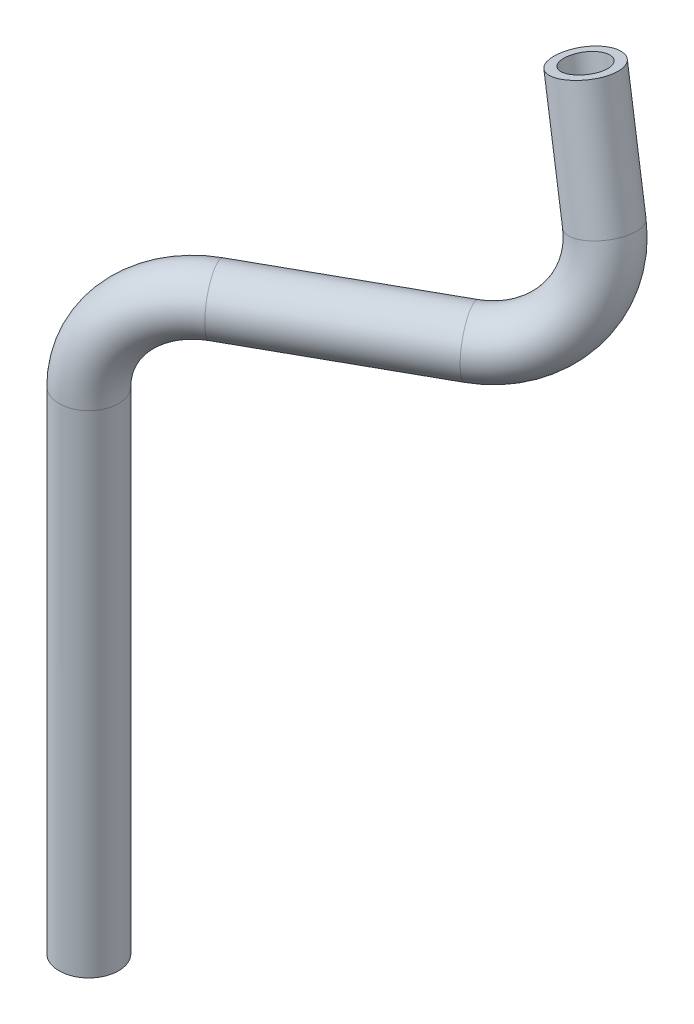
from build123d import *

# Parameters (mm, degrees)
SWEEP_THIN1_PROFILE_R     = 3.175
SWEEP_THIN1_PROFILE_R_2   = 2.175
BOSS_EXTRUDE1_OUTLINE_R   = 3.175
BOSS_EXTRUDE1_OUTLINE_R_2 = 2.175
BOSS_EXTRUDE1_DEPTH       = 5.033072262
BOSS_EXTRUDE1_START       = 3
BOSS_EXTRUDE1_2_DEPTH     = 8


with BuildPart() as part:
    # Sweep-Thin1: sweep along a curve in space
    with BuildLine() as sweep_thin1_path:
        Line((0, 0, 0), (0, 41.3, 0))
        Line((0, 41.3, 0), (0, 52.485381189, 0))
        ThreePointArc((8.731710823, 62.485381189, -4.874138499), (2.557458889, 59.556449001, -1.427602114), (0, 52.485381189, 0))
        Line((8.731710823, 62.485381189, -4.874138499), (26.239628077, 62.485381189, -14.647253442))
        ThreePointArc((26.239628077, 62.485381189, -14.647253442), (32.596698174, 65.949204532, -18.875029244), (33.90761411, 73.906143624, -21.166997899))
        Line((32.091284349, 81.948727145, -21.730096286), (33.90761411, 73.906143624, -21.166997899))
    # Sweep-Thin1 profile (on start of the path) → Sweep-Thin1 (sweep)
    with BuildSketch(Plane.ZX):
        Circle(SWEEP_THIN1_PROFILE_R)
        Circle(SWEEP_THIN1_PROFILE_R_2, mode=Mode.SUBTRACT)
    sweep(path=sweep_thin1_path.line)

    # Boss-Extrude1: read off the stored shape, not the designer's step
    # Boss-Extrude1 outline → Boss-Extrude1 (add)
    with BuildSketch(Plane(origin=(-16.302656388, 72.187043596, -5.054148045), x_dir=(0.9755496373305654, 0.2192425074835292, -0.015350179690706331), z_dir=(-0.21977921899989167, 0.973167297783081, -0.06813593340796047))):
        with Locations((49.606846115, 15.953433297)):
            Circle(BOSS_EXTRUDE1_OUTLINE_R)
        with Locations((49.606846115, 15.953433297)):
            Circle(BOSS_EXTRUDE1_OUTLINE_R_2, mode=Mode.SUBTRACT)
    extrude(amount=BOSS_EXTRUDE1_DEPTH)

    # Boss-Extrude1 2 outline → Boss-Extrude1 2 (cut)
    with BuildSketch(Plane(origin=(0, 0, 0), x_dir=(0.9092183851510403, -0.07176325268657005, -0.4100877511791569), z_dir=(0.41631950242972593, 0.156726908876634, 0.8956085908088649)).offset(BOSS_EXTRUDE1_START)):
        with BuildLine():
            ThreePointArc((30.991714154, 89.351616158), (32.537128586, 89.718539367), (34.090261078, 90.051282317))
            Line((34.090261078, 90.051282317), (35, 90.235713443))
            Line((35, 90.235713443), (35, 90.350121944))
            Line((35, 90.350121944), (34.072560393, 90.119086943))
            Line((34.072560393, 90.119086943), (30.991714154, 89.351616158))
        make_face()
        with BuildLine():
            ThreePointArc((27.927036801, 88.515957727), (29.454766368, 88.950690302), (30.991714154, 89.351616158))
            Line((30.991714154, 89.351616158), (27.910868159, 88.584144334))
            Line((27.910868159, 88.584144334), (27, 88.357237456))
            Line((27, 88.357237456), (27, 88.241069912))
            Line((27, 88.241069912), (27.927036801, 88.515957727))
        make_face()
    extrude(amount=BOSS_EXTRUDE1_2_DEPTH, mode=Mode.SUBTRACT)


solid = part.part
